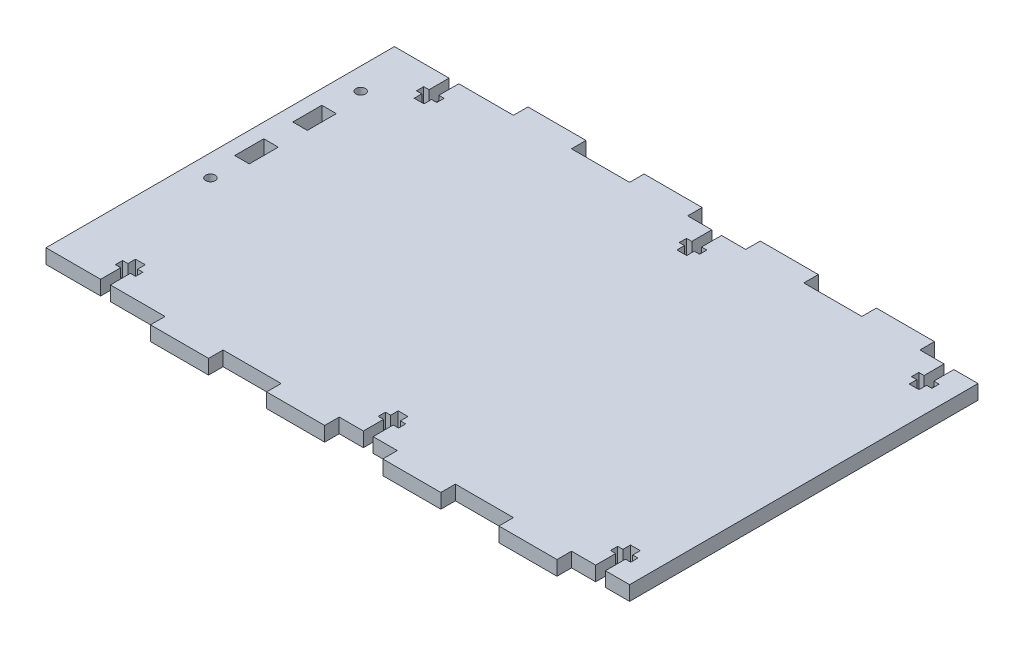
from build123d import *

# Parameters (mm, degrees)
SKETCH1_W           = 255.259874896
SKETCH1_H           = 6.35
BOSS_EXTRUDE1_DEPTH = 152.4
SKETCH2_W           = 25.4
SKETCH2_H           = 6.35
BOSS_EXTRUDE2_DEPTH = 6.35
LPATTERN1_COUNT     = 4
LPATTERN1_PITCH     = 50.8
SKETCH3_W           = 25.4
SKETCH3_H           = 6.35
BOSS_EXTRUDE3_DEPTH = 6.35
LPATTERN2_COUNT     = 4
LPATTERN2_PITCH     = 50.8
CUT_EXTRUDE1_DEPTH  = 6.35
SKETCH5_W           = 6.35
SKETCH5_H           = 12.7
CUT_EXTRUDE2_DEPTH  = 212.329778686
SKETCH6_R           = 2.0955
CUT_EXTRUDE3_DEPTH  = 212.329778686


with BuildPart() as part:
    # Sketch1 → Boss-Extrude1 (new body)
    with BuildSketch(Plane.XY):
        with Locations((-11.719947229, 152.4)):
            Rectangle(SKETCH1_W, SKETCH1_H)
    extrude(amount=BOSS_EXTRUDE1_DEPTH)

    # Sketch2 → Boss-Extrude2 (add)
    with BuildSketch(Plane(origin=(0, 155.575, 0), x_dir=(1, 0, 0), z_dir=(0, 1, 0))):
        with Locations((77.809990219, 3.175)):
            Rectangle(SKETCH2_W, SKETCH2_H)
    boss_extrude2 = extrude(amount=-BOSS_EXTRUDE2_DEPTH)

    # LPattern1: Boss-Extrude2 ×4
    with Locations(*[(-i * LPATTERN1_PITCH, 0, 0) for i in range(1, LPATTERN1_COUNT)]):
        add(boss_extrude2)

    # Sketch3 → Boss-Extrude3 (add)
    with BuildSketch(Plane.XY.offset(152.4)):
        with Locations((77.809990219, 152.4)):
            Rectangle(SKETCH3_W, SKETCH3_H)
    boss_extrude3 = extrude(amount=BOSS_EXTRUDE3_DEPTH)

    # LPattern2: Boss-Extrude3 ×4
    with Locations(*[(-i * LPATTERN2_PITCH, 0, 0) for i in range(1, LPATTERN2_COUNT)]):
        add(boss_extrude3)

    # Sketch4 → Cut-Extrude1 (cut)
    with BuildSketch(Plane(origin=(0, 155.575, 0), x_dir=(1, 0, 0), z_dir=(0, 1, 0))):
        Polygon((-111.186347229, 0), (-115.453547229, 0), (-115.453547229, -8.763), (-117.764947229, -8.763), (-117.764947229, -11.938), (-115.453547229, -11.938), (-115.453547229, -15.24), (-111.186347229, -15.24), (-111.186347229, -11.938), (-108.874947229, -11.938), (-108.874947229, -8.763), (-111.186347229, -8.763), align=None)
        Polygon((3.743590219, 0), (-0.523609781, 0), (-0.523609781, -8.763), (-2.835009781, -8.763), (-2.835009781, -11.938), (-0.523609781, -11.938), (-0.523609781, -15.24), (3.743590219, -15.24), (3.743590219, -11.938), (6.054990219, -11.938), (6.054990219, -8.763), (3.743590219, -8.763), align=None)
        Polygon((105.343590219, 0), (101.076390219, 0), (101.076390219, -8.763), (98.764990219, -8.763), (98.764990219, -11.938), (101.076390219, -11.938), (101.076390219, -15.24), (105.343590219, -15.24), (105.343590219, -11.938), (107.654990219, -11.938), (107.654990219, -8.763), (105.343590219, -8.763), align=None)
        Polygon((-115.453547229, -152.4), (-111.186347229, -152.4), (-111.186347229, -143.637), (-108.874947229, -143.637), (-108.874947229, -140.462), (-111.186347229, -140.462), (-111.186347229, -137.16), (-115.453547229, -137.16), (-115.453547229, -140.462), (-117.764947229, -140.462), (-117.764947229, -143.637), (-115.453547229, -143.637), align=None)
        Polygon((-0.523609781, -152.4), (3.743590219, -152.4), (3.743590219, -143.637), (6.054990219, -143.637), (6.054990219, -140.462), (3.743590219, -140.462), (3.743590219, -137.16), (-0.523609781, -137.16), (-0.523609781, -140.462), (-2.835009781, -140.462), (-2.835009781, -143.637), (-0.523609781, -143.637), align=None)
        Polygon((101.076390219, -152.4), (105.343590219, -152.4), (105.343590219, -143.637), (107.654990219, -143.637), (107.654990219, -140.462), (105.343590219, -140.462), (105.343590219, -137.16), (101.076390219, -137.16), (101.076390219, -140.462), (98.764990219, -140.462), (98.764990219, -143.637), (101.076390219, -143.637), align=None)
    extrude(amount=-CUT_EXTRUDE1_DEPTH, mode=Mode.SUBTRACT)

    # Sketch5 → Cut-Extrude2 (cut, through all)
    with BuildSketch(Plane(origin=(0, 155.575, 0), x_dir=(1, 0, 0), z_dir=(0, 1, 0))):
        with Locations((-129.824884677, -44.45)):
            Rectangle(SKETCH5_W, SKETCH5_H)
        with Locations((-129.824884677, -69.85)):
            Rectangle(SKETCH5_W, SKETCH5_H)
    extrude(amount=-CUT_EXTRUDE2_DEPTH, mode=Mode.SUBTRACT)

    # Sketch6 → Cut-Extrude3 (cut, through all)
    with BuildSketch(Plane(origin=(0, 155.575, 0), x_dir=(1, 0, 0), z_dir=(0, 1, 0))):
        with Locations((-129.824884677, -89.98)):
            Circle(SKETCH6_R)
        with Locations((-129.824884677, -24.32)):
            Circle(SKETCH6_R)
    extrude(amount=-CUT_EXTRUDE3_DEPTH, mode=Mode.SUBTRACT)


solid = part.part
